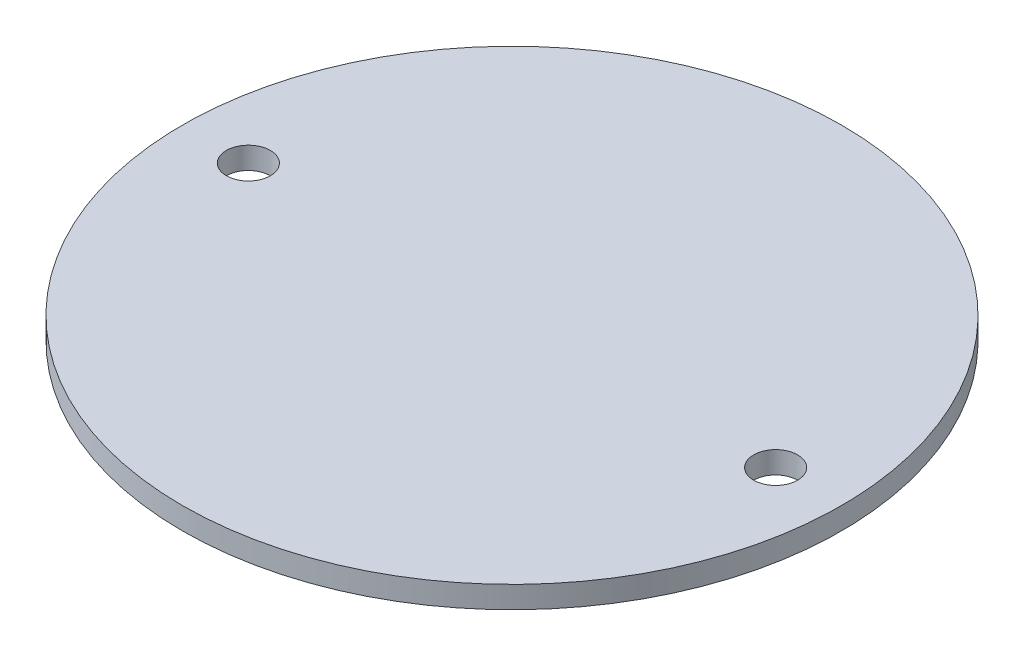
from build123d import *

# Parameters (mm, degrees)
SKETCH1_R           = 47.625
BOSS_EXTRUDE1_DEPTH = 3.175
SKETCH2_R           = 3.175
CUT_EXTRUDE1_DEPTH  = 263.398


with BuildPart() as part:
    # Sketch1 → Boss-Extrude1 (new body)
    with BuildSketch(Plane(origin=(0, 0, 0), x_dir=(1, 0, 0), z_dir=(0, 1, 0))):
        Circle(SKETCH1_R)
    extrude(amount=BOSS_EXTRUDE1_DEPTH)

    # Sketch2 → Cut-Extrude1 (cut)
    with BuildSketch(Plane(origin=(-55.039702575, 231.775, -116.088398355), x_dir=(-1, 0, 0), z_dir=(0, 1, 0))):
        with Locations((-93.139702575, 116.088398355)):
            Circle(SKETCH2_R)
        with Locations((-16.939702575, 116.088398355)):
            Circle(SKETCH2_R)
    extrude(amount=-CUT_EXTRUDE1_DEPTH, mode=Mode.SUBTRACT)


solid = part.part
